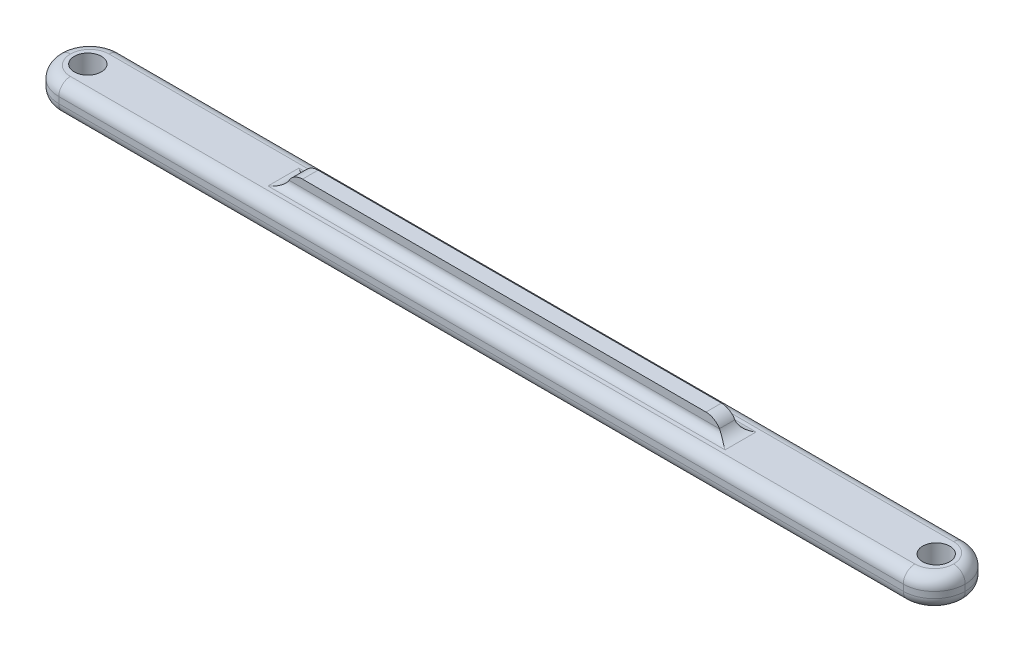
from build123d import *

# Parameters (mm, degrees)
SKETCH1_W                = 117
SKETCH1_H                = 8
BOSS_EXTRUDE1_DEPTH      = 3.8
SKETCH2_R                = 1.75
CUT_EXTRUDE4_DEPTH       = 59.759594961
FILLET1_R                = 4
FILLET2_R                = 1.5
BOSS_EXTRUDE2_DEPTH      = 2
BOSS_EXTRUDE2_DEPTH_BACK = 5.8
SKETCH3_W                = 55
SKETCH3_H                = 2
FILLET3_R                = 2
FILLET4_R                = 2
FILLET5_R                = 1


with BuildPart() as part:
    # Sketch1 → Boss-Extrude1 (new body)
    with BuildSketch(Plane(origin=(0, 0, 0), x_dir=(1, 0, 0), z_dir=(0, 1, 0))):
        Rectangle(SKETCH1_W, SKETCH1_H)
    extrude(amount=BOSS_EXTRUDE1_DEPTH)

    # Sketch2 → Cut-Extrude4 (cut, through all)
    with BuildSketch(Plane(origin=(0, 3.8, 0), x_dir=(1, 0, 0), z_dir=(0, 1, 0))):
        with Locations(Location((-54.75, 0, 0), (0, 0, 270))):
            Circle(SKETCH2_R)
        with Locations(Location((54.75, 0, 0), (0, 0, 270))):
            Circle(SKETCH2_R)
    extrude(amount=-CUT_EXTRUDE4_DEPTH, mode=Mode.SUBTRACT)

    # Fillet1
    fillet1_edges = [part.edges().sort_by_distance(p)[0] for p in [
        (58.5, 1.9, -4),
        (58.5, 1.9, 4),
        (-58.5, 1.9, 4),
        (-58.5, 1.9, -4),
    ]]
    fillet(fillet1_edges, radius=FILLET1_R - 0.0001)  # a hair under: the kernel refuses the full size

    # Fillet2
    fillet2_edges = [part.edges().sort_by_distance(p)[0] for p in [
        (0, 0, -4),
        (0, 3.8, -4),
        (0, 0, 4),
        (-57.328456414, 0, -2.828456414),
        (-57.328456414, 0, 2.828456414),
        (57.328456414, 0, 2.828456414),
        (57.328456414, 0, -2.828456414),
        (0, 3.8, 4),
        (-57.328456414, 3.8, -2.828456414),
        (-57.328456414, 3.8, 2.828456414),
        (57.328456414, 3.8, 2.828456414),
        (57.328456414, 3.8, -2.828456414),
    ]]
    fillet(fillet2_edges, radius=FILLET2_R)

    # Sketch3 → Boss-Extrude2 (add, two sides: drawn at the far end of the back side and taken through both)
    with BuildSketch(Plane(origin=(0, 3.8, 0), x_dir=(1, 0, 0), z_dir=(0, 1, 0)).offset(-BOSS_EXTRUDE2_DEPTH_BACK)):
        Rectangle(SKETCH3_W, SKETCH3_H)
    extrude(amount=BOSS_EXTRUDE2_DEPTH + BOSS_EXTRUDE2_DEPTH_BACK)

    # Fillet3
    fillet3_edges = [part.edges().sort_by_distance(p)[0] for p in [
        (-27.5, 0, 0),
        (27.5, 0, 0),
        (-27.5, 3.8, 0),
        (27.5, 3.8, 0),
    ]]
    fillet(fillet3_edges, radius=FILLET3_R - 0.0001)  # a hair under: the kernel refuses the full size

    # Fillet4
    fillet4_edges = [part.edges().sort_by_distance(p)[0] for p in [
        (27.5, -2, 0),
        (-27.5, -2, 0),
        (27.5, 5.8, 0),
        (-27.5, 5.8, 0),
    ]]
    fillet(fillet4_edges, radius=FILLET4_R)

    # Fillet5
    fillet5_edges = [part.edges().sort_by_distance(p)[0] for p in [
        (0, 3.8, -1),
        (0, 3.8, 1),
        (0, 0, 1),
        (0, 0, -1),
    ]]
    fillet(fillet5_edges, radius=FILLET5_R - 0.0001)  # a hair under: the kernel refuses the full size


solid = part.part
